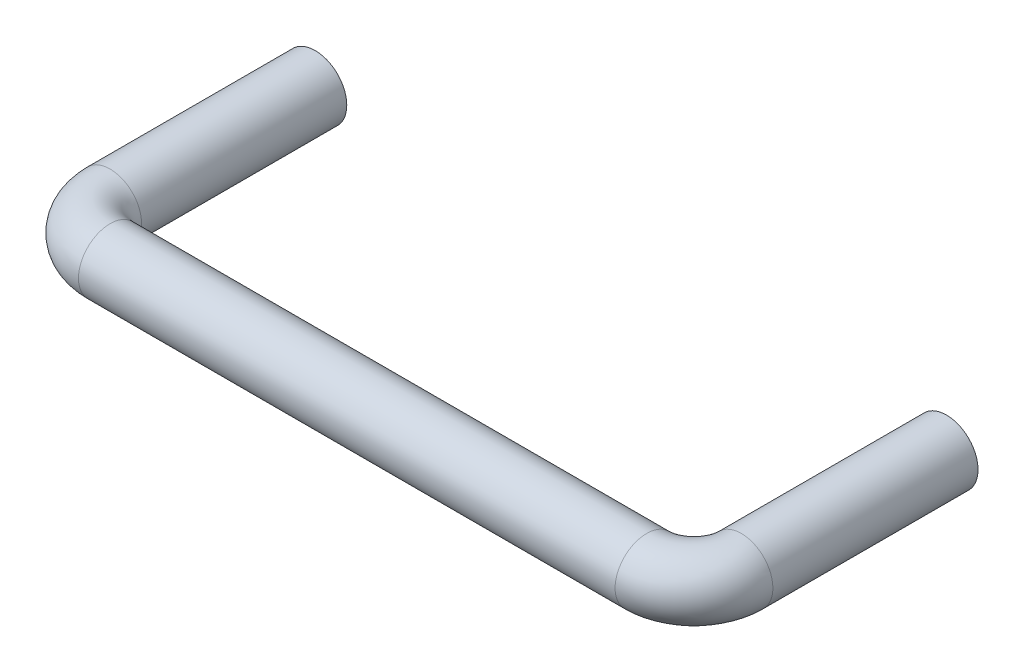
from build123d import *
from build123d.topology import SkipClean

# Parameters (mm, degrees)
SKETCH3_R     = 5
THREAD1_PITCH = 0.5


with BuildPart() as part:
    # Sweep1: sweep along a path in Sketch2
    with BuildLine(Plane(origin=(0, 0, 0), x_dir=(1, 0, 0), z_dir=(0, 1, 0))) as sweep1_path:
        Line((0, 0), (42.5, 0))
        ThreePointArc((42.5, 0), (47.803300859, 2.196699141), (50, 7.5))
        Line((50, 7.5), (50, 40))
    # Sketch3 → Sweep1 (sweep)
    with BuildSketch(Plane(origin=(0, 0, 0), x_dir=(0, 0, -1), z_dir=(1, 0, 0))):
        Circle(SKETCH3_R)
    sweep1 = sweep(path=sweep1_path.line)

    # Sketch5 → Ø3.0 (3) Diameter Hole1 (revolve, cut)
    with BuildSketch(Plane(origin=(50, 0, -40), x_dir=(0, 1, 0), z_dir=(1, 0, 0))):
        Polygon((0, 0), (0, 10.901290929), (1.5, 10), (1.5, 0.025), (1.525, 0), align=None)
    f_3_0_3_diameter_hole1 = revolve(axis=Axis((50, 0, -46.35), (0, 0, 1)), mode=Mode.SUBTRACT)

    # Thread1: arcs per turn and ends read off the stored shape
    # Thread1: the profile of Thread Profile2 profile screwed along a right-hand helix through 19.95 turns, 6 arcs to a turn; built about Z, then put on its axis
    thread1_z = Axis((0, 0, 0), (0, 0, 1))
    thread1_corners = [(1.4997, 0, -0.000173205), (1.770632938, 0, 0.156249999), (1.770632938, 0, 0.218749999), (1.4997, 0, 0.375173204)]
    with BuildLine(mode=Mode.PRIVATE) as thread1_profile:
        Line(thread1_corners[0], thread1_corners[1])
        Line(thread1_corners[1], thread1_corners[2])
        Line(thread1_corners[2], thread1_corners[3])
        Line(thread1_corners[3], thread1_corners[0])
    thread1_cap = Face(thread1_profile.wire())
    thread1_turn_angles = [0, 30, 60, 90, 120, 150, 180, 210, 240, 270, 300, 330, 360]
    thread1_turn_weights = [1, 0.8660254037844387, 1, 0.8660254037844387, 1, 0.8660254037844387, 1, 0.8660254037844387, 1, 0.8660254037844387, 1, 0.8660254037844387, 1]
    thread1_turn_rails = [Edge.make_bspline([Vector(p[0], p[1], 0).rotate(thread1_z, thread1_turn_angles[k]) / thread1_turn_weights[k] + Vector(0, 0, p[2] + THREAD1_PITCH * thread1_turn_angles[k] / 360) for k in range(13)], [0, 0, 0, 1, 1, 2, 2, 3, 3, 4, 4, 5, 5, 6, 6, 6], 2, thread1_turn_weights) for p in thread1_corners]
    thread1_turn_sides = [Face.make_surface_from_curves(thread1_turn_rails[p[0]], thread1_turn_rails[p[1]]) for p in [(0, 1), (1, 2), (2, 3), (3, 0)]]
    thread1_last_angles = [6840, 6870, 6900, 6930, 6960, 6990, 7020, 7050, 7080, 7110, 7140, 7161, 7182]
    thread1_last_weights = [1, 0.8660254037844387, 1, 0.8660254037844387, 1, 0.8660254037844387, 1, 0.8660254037844387, 1, 0.8660254037844387, 1, 0.9335804264972074, 1]
    thread1_last_rails = [Edge.make_bspline([Vector(p[0], p[1], 0).rotate(thread1_z, thread1_last_angles[k]) / thread1_last_weights[k] + Vector(0, 0, p[2] + THREAD1_PITCH * thread1_last_angles[k] / 360) for k in range(13)], [0, 0, 0, 1, 1, 2, 2, 3, 3, 4, 4, 5, 5, 6, 6, 6], 2, thread1_last_weights) for p in thread1_corners]
    thread1_last_sides = [Face.make_surface_from_curves(thread1_last_rails[p[0]], thread1_last_rails[p[1]]) for p in [(0, 1), (1, 2), (2, 3), (3, 0)]]
    thread1 = Plane(origin=(50, 0, -39.975), x_dir=(1, 0, 0), z_dir=(0, 0, 1)) * Solid(Shell([*[p.moved(Location((0, 0, THREAD1_PITCH * i))) for i in range(19) for p in thread1_turn_sides], *thread1_last_sides, thread1_cap, thread1_cap.rotate(thread1_z, 7182).moved(Location((0, 0, THREAD1_PITCH * 7182 / 360)))]))
    add(thread1, mode=Mode.SUBTRACT)

    # Mirror1: Sweep1, Ø3.0 (3) Diameter Hole1, Thread1 across plane
    with SkipClean():  # the faces are left unmerged after this step: merging them gives an invalid solid
        add(sweep1.mirror(Plane(origin=(0, 0, 0), x_dir=(0, 0, 1), z_dir=(1, 0, 0))))
        add(f_3_0_3_diameter_hole1.mirror(Plane(origin=(0, 0, 0), x_dir=(0, 0, 1), z_dir=(1, 0, 0))), mode=Mode.SUBTRACT)
        add(thread1.mirror(Plane(origin=(0, 0, 0), x_dir=(0, 0, 1), z_dir=(1, 0, 0))), mode=Mode.SUBTRACT)


solid = part.part
